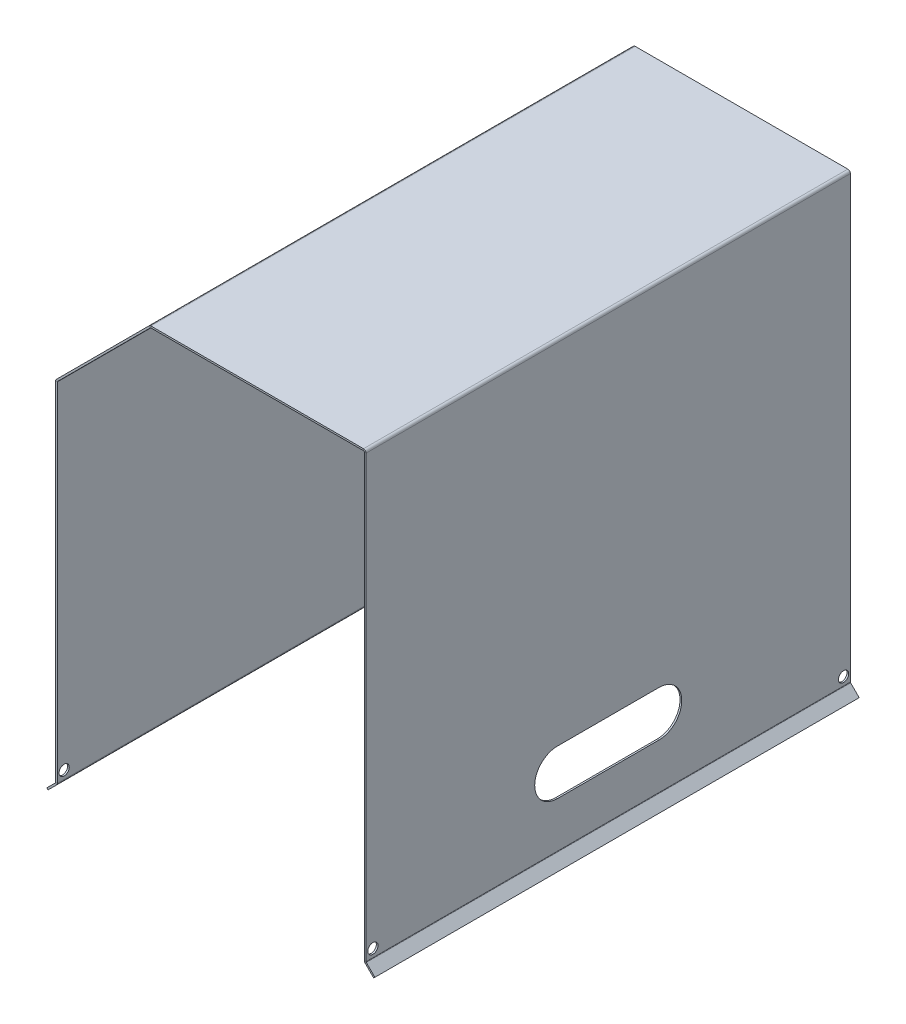
from build123d import *

# Parameters (mm, degrees)
SM_START               = -205
SM_BASE_FLANGE_1_DEPTH = 213
SKETCH_6_R             = 4.5
CUT_EXTRUDE_1_DEPTH    = 523.867356878
CUT_EXTRUDE_2_DEPTH    = 10
CUT_EXTRUDE_3_DEPTH    = 10


# Sheet-metal steps are written as plain solids
with BuildPart() as part:
    # Sketch 1 → Базовая кромка1 (new body)
    with BuildSketch(Plane.XY.offset(SM_START)):
        with BuildLine():
            Line((-8.209607948, -8.209607948), (-0.659009742, -0.659009742))
            ThreePointArc((-0.659009742, -0.659009742), (-0.171271052, 0.070942793), (0, 0.931980515))
            Line((0, 0.931980515), (0, 306.689339828))
            ThreePointArc((0, 306.689339828), (0.057090351, 306.976352402), (0.219669914, 307.219669914))
            Line((0.219669914, 307.219669914), (81.780330086, 388.780330086))
            ThreePointArc((81.780330086, 388.780330086), (82.023647597, 388.942909649), (82.310660172, 389))
            Line((82.310660172, 389), (269.326706029, 389))
            ThreePointArc((269.326706029, 389), (269.857036115, 388.780330086), (270.076706029, 388.25))
            Line((270.076706029, 388.25), (270.076706029, 0.931980515))
            ThreePointArc((270.076706029, 0.931980515), (270.247977081, 0.070942793), (270.735715771, -0.659009742))
            Line((270.735715771, -0.659009742), (278.286313977, -8.209607948))
            Line((278.286313977, -8.209607948), (279.346974149, -7.148947776))
            Line((279.346974149, -7.148947776), (271.796375943, 0.401650429))
            ThreePointArc((271.796375943, 0.401650429), (271.63379638, 0.644967941), (271.576706029, 0.931980515))
            Line((271.576706029, 0.931980515), (271.576706029, 388.25))
            ThreePointArc((271.576706029, 388.25), (270.917696287, 389.840990258), (269.326706029, 390.5))
            Line((269.326706029, 390.5), (82.310660172, 390.5))
            ThreePointArc((82.310660172, 390.5), (81.449622449, 390.328728948), (80.719669914, 389.840990257))
            Line((80.719669914, 389.840990258), (-0.840990258, 308.280330086))
            ThreePointArc((-0.840990258, 308.280330086), (-1.328728948, 307.550377551), (-1.5, 306.689339828))
            Line((-1.5, 306.689339828), (-1.5, 0.931980515))
            ThreePointArc((-1.5, 0.931980515), (-1.557090351, 0.644967941), (-1.719669914, 0.401650429))
            Line((-1.719669914, 0.401650429), (-9.270268119, -7.148947776))
            Line((-9.270268119, -7.148947776), (-8.209607948, -8.209607948))
        make_face()
    extrude(amount=SM_BASE_FLANGE_1_DEPTH)

    # Эскиз6 → Вырез-Вытянуть1 (cut, through all)
    with BuildSketch(Plane.ZY.offset(1.5)):
        with Locations(Location((2, 8, 0), (0, 0, 270))):
            Circle(SKETCH_6_R)
    extrude(amount=-CUT_EXTRUDE_1_DEPTH, mode=Mode.SUBTRACT)

    # Эскиз7 → Вырез-Вытянуть2 (cut)
    with BuildSketch(Plane(origin=(-154.560660172, 154.560660172, 0), x_dir=(0, 0, 1), z_dir=(-0.7071067811865465, 0.7071067811865487, 0))):
        Polygon((-44, 327.736633767), (-42, 327.736633767), (-42, 307.736633767), (-155, 307.736633767), (-155, 327.736633767), (-153, 327.736633767), (-153, 309.736633767), (-44, 309.736633767), align=None)
        with BuildLine():
            Line((-138, 328.736633767), (-106.5, 328.736633767))
            ThreePointArc((-106.5, 328.736633767), (-105.5, 327.736633767), (-106.5, 326.736633767))
            Line((-106.5, 326.736633767), (-138, 326.736633767))
            ThreePointArc((-138, 326.736633767), (-139, 327.736633767), (-138, 328.736633767))
        make_face()
        with BuildLine():
            Line((-59, 328.736633767), (-90.5, 328.736633767))
            ThreePointArc((-90.5, 328.736633767), (-91.5, 327.736633767), (-90.5, 326.736633767))
            Line((-90.5, 326.736633767), (-59, 326.736633767))
            ThreePointArc((-59, 326.736633767), (-58, 327.736633767), (-59, 328.736633767))
        make_face()
        Polygon((-153, 287.736633767), (-153, 269.736633767), (-44, 269.736633767), (-44, 287.736633767), (-42, 287.736633767), (-42, 267.736633767), (-155, 267.736633767), (-155, 287.736633767), align=None)
        with BuildLine():
            Line((-138, 288.736633767), (-106.5, 288.736633767))
            ThreePointArc((-106.5, 288.736633767), (-105.5, 287.736633767), (-106.5, 286.736633767))
            Line((-106.5, 286.736633767), (-138, 286.736633767))
            ThreePointArc((-138, 286.736633767), (-139, 287.736633767), (-138, 288.736633767))
        make_face()
        with BuildLine():
            Line((-59, 288.736633767), (-90.5, 288.736633767))
            ThreePointArc((-90.5, 288.736633767), (-91.5, 287.736633767), (-90.5, 286.736633767))
            Line((-90.5, 286.736633767), (-59, 286.736633767))
            ThreePointArc((-59, 286.736633767), (-58, 287.736633767), (-59, 288.736633767))
        make_face()
        Polygon((-153, 247.736633767), (-153, 229.736633767), (-44, 229.736633767), (-44, 247.736633767), (-42, 247.736633767), (-42, 227.736633767), (-155, 227.736633767), (-155, 247.736633767), align=None)
        with BuildLine():
            Line((-138, 248.736633767), (-106.5, 248.736633767))
            ThreePointArc((-106.5, 248.736633767), (-105.5, 247.736633767), (-106.5, 246.736633767))
            Line((-106.5, 246.736633767), (-138, 246.736633767))
            ThreePointArc((-138, 246.736633767), (-139, 247.736633767), (-138, 248.736633767))
        make_face()
        with BuildLine():
            Line((-59, 248.736633767), (-90.5, 248.736633767))
            ThreePointArc((-90.5, 248.736633767), (-91.5, 247.736633767), (-90.5, 246.736633767))
            Line((-90.5, 246.736633767), (-59, 246.736633767))
            ThreePointArc((-59, 246.736633767), (-58, 247.736633767), (-59, 248.736633767))
        make_face()
    extrude(amount=-CUT_EXTRUDE_2_DEPTH, mode=Mode.SUBTRACT)

    # Зеркальное отражение1: part across plane


with BuildPart() as part_1:
    add(part.part)
    add(part.part.mirror(Plane(origin=(271.576706029, 389, -205), x_dir=(1, 0, 0), z_dir=(0, 0, -1))))

    # Эскиз10 → Вырез-Вытянуть3 (cut)
    with BuildSketch(Plane(origin=(271.576706029, 0, 0), x_dir=(0, 0, -1), z_dir=(1, 0, 0))):
        with BuildLine():
            Line((160.336309448, 80.931980515), (249.663690552, 80.931980515))
            ThreePointArc((249.663690552, 80.931980515), (269.663690552, 60.931980515), (249.663690552, 40.931980515))
            Line((249.663690552, 40.931980515), (160.336309448, 40.931980515))
            ThreePointArc((160.336309448, 40.931980515), (140.336309448, 60.931980515), (160.336309448, 80.931980515))
        make_face()
    extrude(amount=-CUT_EXTRUDE_3_DEPTH, mode=Mode.SUBTRACT)


solid = part_1.part
